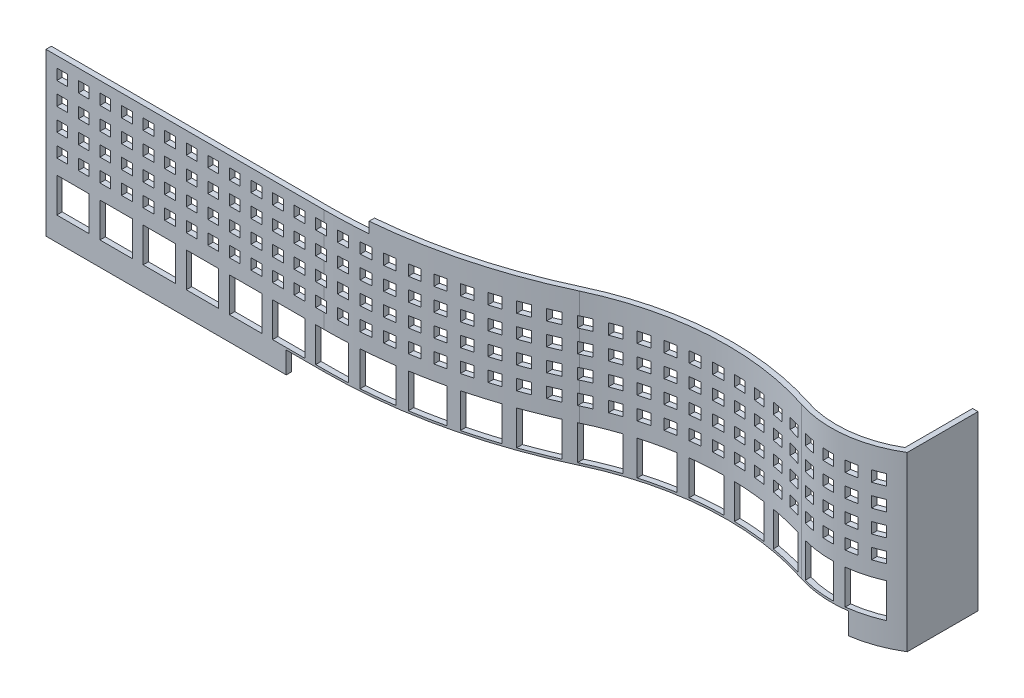
from build123d import *

# Parameters (mm, degrees)
EXTRUDE_1_DEPTH     = 16
SKETCH_2_W          = 29.766559657
SKETCH_2_H          = 1
CUT_EXTRUDE_1_DEPTH = 15
SKETCH_3_W          = 1
SKETCH_3_H          = 1
SKETCH_3_W_2        = 3
SKETCH_3_H_2        = 3.2
SKETCH_3_W_3        = 47
SKETCH_3_H_3        = 5.280191192
CUT_EXTRUDE_2_DEPTH = 61.518592185


with BuildPart() as part:
    # 草图1 → 凸台-拉伸1 (new body)
    with BuildSketch(Plane(origin=(0, 0, 0), x_dir=(1, 0, 0), z_dir=(0, 1, 0))):
        with BuildLine():
            Line((52, -18.660254038), (52, -12.386406803))
            Line((52, -12.386406803), (52.5, -12.386406803))
            Line((52.5, -12.386406803), (52.5, -18.94427191))
            ThreePointArc((52.5, -18.94427191), (48.232411749, -20.427423521), (43.736650726, -19.980007591))
            ThreePointArc((43.736650726, -19.980007591), (33.93226823, -18.726469875), (24.356732206, -21.177262152))
            ThreePointArc((24.356732206, -21.177262152), (14.916767924, -24.406167522), (5, -25.5))
            Line((5, -25.5), (-17.47140521, -25.5))
            Line((-17.47140521, -25.5), (-20.766559657, -25.5))
            Line((-20.766559657, -25.5), (-20.766559657, -25))
            Line((-20.766559657, -25), (-17.47140521, -25))
            Line((-17.47140521, -25), (5, -25))
            ThreePointArc((5, -25), (14.807792452, -23.918187659), (24.144020863, -20.724764765))
            ThreePointArc((24.144020863, -20.724764765), (33.901437956, -18.227421286), (43.892048311, -19.504769134))
            ThreePointArc((43.892048311, -19.504769134), (48.035984141, -19.946192078), (52, -18.660254038))
        make_face()
    extrude(amount=EXTRUDE_1_DEPTH)

    # 草图2 → 切除-拉伸1 (cut)
    with BuildSketch(Plane.XY.offset(25.5)):
        with Locations((-5.883279829, 15.5)):
            Rectangle(SKETCH_2_W, SKETCH_2_H)
    extrude(amount=-CUT_EXTRUDE_1_DEPTH, mode=Mode.SUBTRACT)

    # 草图3 → 切除-拉伸2 (cut, through all)
    with BuildSketch(Plane.XY):
        with Locations((48.733440343, 13.5)):
            Rectangle(SKETCH_3_W, SKETCH_3_H)
        with Locations((-19.266559657, 13.5)):
            Rectangle(SKETCH_3_W, SKETCH_3_H)
        with Locations((-17.266559657, 13.5)):
            Rectangle(SKETCH_3_W, SKETCH_3_H)
        with Locations((-15.266559657, 13.5)):
            Rectangle(SKETCH_3_W, SKETCH_3_H)
        with Locations((-13.266559657, 13.5)):
            Rectangle(SKETCH_3_W, SKETCH_3_H)
        with Locations((-11.266559657, 13.5)):
            Rectangle(SKETCH_3_W, SKETCH_3_H)
        with Locations((-9.266559657, 13.5)):
            Rectangle(SKETCH_3_W, SKETCH_3_H)
        with Locations((-7.266559657, 13.5)):
            Rectangle(SKETCH_3_W, SKETCH_3_H)
        with Locations((-5.266559657, 13.5)):
            Rectangle(SKETCH_3_W, SKETCH_3_H)
        with Locations((-3.266559657, 13.5)):
            Rectangle(SKETCH_3_W, SKETCH_3_H)
        with Locations((-1.266559657, 13.5)):
            Rectangle(SKETCH_3_W, SKETCH_3_H)
        with Locations((0.733440343, 13.5)):
            Rectangle(SKETCH_3_W, SKETCH_3_H)
        with Locations((2.733440343, 13.5)):
            Rectangle(SKETCH_3_W, SKETCH_3_H)
        with Locations((4.733440343, 13.5)):
            Rectangle(SKETCH_3_W, SKETCH_3_H)
        with Locations((6.733440343, 13.5)):
            Rectangle(SKETCH_3_W, SKETCH_3_H)
        with Locations((8.733440343, 13.5)):
            Rectangle(SKETCH_3_W, SKETCH_3_H)
        with Locations((10.733440343, 13.5)):
            Rectangle(SKETCH_3_W, SKETCH_3_H)
        with Locations((12.733440343, 13.5)):
            Rectangle(SKETCH_3_W, SKETCH_3_H)
        with Locations((14.733440343, 13.5)):
            Rectangle(SKETCH_3_W, SKETCH_3_H)
        with Locations((16.733440343, 13.5)):
            Rectangle(SKETCH_3_W, SKETCH_3_H)
        with Locations((18.733440343, 13.5)):
            Rectangle(SKETCH_3_W, SKETCH_3_H)
        with Locations((20.733440343, 13.5)):
            Rectangle(SKETCH_3_W, SKETCH_3_H)
        with Locations((22.733440343, 13.5)):
            Rectangle(SKETCH_3_W, SKETCH_3_H)
        with Locations((24.733440343, 13.5)):
            Rectangle(SKETCH_3_W, SKETCH_3_H)
        with Locations((26.733440343, 13.5)):
            Rectangle(SKETCH_3_W, SKETCH_3_H)
        with Locations((28.733440343, 13.5)):
            Rectangle(SKETCH_3_W, SKETCH_3_H)
        with Locations((30.733440343, 13.5)):
            Rectangle(SKETCH_3_W, SKETCH_3_H)
        with Locations((32.733440343, 13.5)):
            Rectangle(SKETCH_3_W, SKETCH_3_H)
        with Locations((34.733440343, 13.5)):
            Rectangle(SKETCH_3_W, SKETCH_3_H)
        with Locations((36.733440343, 13.5)):
            Rectangle(SKETCH_3_W, SKETCH_3_H)
        with Locations((38.733440343, 13.5)):
            Rectangle(SKETCH_3_W, SKETCH_3_H)
        with Locations((40.733440343, 13.5)):
            Rectangle(SKETCH_3_W, SKETCH_3_H)
        with Locations((42.733440343, 13.5)):
            Rectangle(SKETCH_3_W, SKETCH_3_H)
        with Locations((44.733440343, 13.5)):
            Rectangle(SKETCH_3_W, SKETCH_3_H)
        with Locations((46.733440343, 13.5)):
            Rectangle(SKETCH_3_W, SKETCH_3_H)
        with Locations((-19.266559657, 11.425)):
            Rectangle(SKETCH_3_W, SKETCH_3_H)
        with Locations((-17.266559657, 11.425)):
            Rectangle(SKETCH_3_W, SKETCH_3_H)
        with Locations((-15.266559657, 11.425)):
            Rectangle(SKETCH_3_W, SKETCH_3_H)
        with Locations((-13.266559657, 11.425)):
            Rectangle(SKETCH_3_W, SKETCH_3_H)
        with Locations((-11.266559657, 11.425)):
            Rectangle(SKETCH_3_W, SKETCH_3_H)
        with Locations((-9.266559657, 11.425)):
            Rectangle(SKETCH_3_W, SKETCH_3_H)
        with Locations((-7.266559657, 11.425)):
            Rectangle(SKETCH_3_W, SKETCH_3_H)
        with Locations((-5.266559657, 11.425)):
            Rectangle(SKETCH_3_W, SKETCH_3_H)
        with Locations((-3.266559657, 11.425)):
            Rectangle(SKETCH_3_W, SKETCH_3_H)
        with Locations((-1.266559657, 11.425)):
            Rectangle(SKETCH_3_W, SKETCH_3_H)
        with Locations((0.733440343, 11.425)):
            Rectangle(SKETCH_3_W, SKETCH_3_H)
        with Locations((2.733440343, 11.425)):
            Rectangle(SKETCH_3_W, SKETCH_3_H)
        with Locations((4.733440343, 11.425)):
            Rectangle(SKETCH_3_W, SKETCH_3_H)
        with Locations((6.733440343, 11.425)):
            Rectangle(SKETCH_3_W, SKETCH_3_H)
        with Locations((8.733440343, 11.425)):
            Rectangle(SKETCH_3_W, SKETCH_3_H)
        with Locations((10.733440343, 11.425)):
            Rectangle(SKETCH_3_W, SKETCH_3_H)
        with Locations((12.733440343, 11.425)):
            Rectangle(SKETCH_3_W, SKETCH_3_H)
        with Locations((14.733440343, 11.425)):
            Rectangle(SKETCH_3_W, SKETCH_3_H)
        with Locations((16.733440343, 11.425)):
            Rectangle(SKETCH_3_W, SKETCH_3_H)
        with Locations((18.733440343, 11.425)):
            Rectangle(SKETCH_3_W, SKETCH_3_H)
        with Locations((20.733440343, 11.425)):
            Rectangle(SKETCH_3_W, SKETCH_3_H)
        with Locations((22.733440343, 11.425)):
            Rectangle(SKETCH_3_W, SKETCH_3_H)
        with Locations((24.733440343, 11.425)):
            Rectangle(SKETCH_3_W, SKETCH_3_H)
        with Locations((26.733440343, 11.425)):
            Rectangle(SKETCH_3_W, SKETCH_3_H)
        with Locations((28.733440343, 11.425)):
            Rectangle(SKETCH_3_W, SKETCH_3_H)
        with Locations((30.733440343, 11.425)):
            Rectangle(SKETCH_3_W, SKETCH_3_H)
        with Locations((32.733440343, 11.425)):
            Rectangle(SKETCH_3_W, SKETCH_3_H)
        with Locations((34.733440343, 11.425)):
            Rectangle(SKETCH_3_W, SKETCH_3_H)
        with Locations((36.733440343, 11.425)):
            Rectangle(SKETCH_3_W, SKETCH_3_H)
        with Locations((38.733440343, 11.425)):
            Rectangle(SKETCH_3_W, SKETCH_3_H)
        with Locations((40.733440343, 11.425)):
            Rectangle(SKETCH_3_W, SKETCH_3_H)
        with Locations((42.733440343, 11.425)):
            Rectangle(SKETCH_3_W, SKETCH_3_H)
        with Locations((44.733440343, 11.425)):
            Rectangle(SKETCH_3_W, SKETCH_3_H)
        with Locations((46.733440343, 11.425)):
            Rectangle(SKETCH_3_W, SKETCH_3_H)
        with Locations((-19.266559657, 9.35)):
            Rectangle(SKETCH_3_W, SKETCH_3_H)
        with Locations((-17.266559657, 9.35)):
            Rectangle(SKETCH_3_W, SKETCH_3_H)
        with Locations((-15.266559657, 9.35)):
            Rectangle(SKETCH_3_W, SKETCH_3_H)
        with Locations((-13.266559657, 9.35)):
            Rectangle(SKETCH_3_W, SKETCH_3_H)
        with Locations((-11.266559657, 9.35)):
            Rectangle(SKETCH_3_W, SKETCH_3_H)
        with Locations((-9.266559657, 9.35)):
            Rectangle(SKETCH_3_W, SKETCH_3_H)
        with Locations((-7.266559657, 9.35)):
            Rectangle(SKETCH_3_W, SKETCH_3_H)
        with Locations((-5.266559657, 9.35)):
            Rectangle(SKETCH_3_W, SKETCH_3_H)
        with Locations((-3.266559657, 9.35)):
            Rectangle(SKETCH_3_W, SKETCH_3_H)
        with Locations((-1.266559657, 9.35)):
            Rectangle(SKETCH_3_W, SKETCH_3_H)
        with Locations((0.733440343, 9.35)):
            Rectangle(SKETCH_3_W, SKETCH_3_H)
        with Locations((2.733440343, 9.35)):
            Rectangle(SKETCH_3_W, SKETCH_3_H)
        with Locations((4.733440343, 9.35)):
            Rectangle(SKETCH_3_W, SKETCH_3_H)
        with Locations((6.733440343, 9.35)):
            Rectangle(SKETCH_3_W, SKETCH_3_H)
        with Locations((8.733440343, 9.35)):
            Rectangle(SKETCH_3_W, SKETCH_3_H)
        with Locations((10.733440343, 9.35)):
            Rectangle(SKETCH_3_W, SKETCH_3_H)
        with Locations((12.733440343, 9.35)):
            Rectangle(SKETCH_3_W, SKETCH_3_H)
        with Locations((14.733440343, 9.35)):
            Rectangle(SKETCH_3_W, SKETCH_3_H)
        with Locations((16.733440343, 9.35)):
            Rectangle(SKETCH_3_W, SKETCH_3_H)
        with Locations((18.733440343, 9.35)):
            Rectangle(SKETCH_3_W, SKETCH_3_H)
        with Locations((20.733440343, 9.35)):
            Rectangle(SKETCH_3_W, SKETCH_3_H)
        with Locations((22.733440343, 9.35)):
            Rectangle(SKETCH_3_W, SKETCH_3_H)
        with Locations((24.733440343, 9.35)):
            Rectangle(SKETCH_3_W, SKETCH_3_H)
        with Locations((26.733440343, 9.35)):
            Rectangle(SKETCH_3_W, SKETCH_3_H)
        with Locations((28.733440343, 9.35)):
            Rectangle(SKETCH_3_W, SKETCH_3_H)
        with Locations((30.733440343, 9.35)):
            Rectangle(SKETCH_3_W, SKETCH_3_H)
        with Locations((32.733440343, 9.35)):
            Rectangle(SKETCH_3_W, SKETCH_3_H)
        with Locations((34.733440343, 9.35)):
            Rectangle(SKETCH_3_W, SKETCH_3_H)
        with Locations((36.733440343, 9.35)):
            Rectangle(SKETCH_3_W, SKETCH_3_H)
        with Locations((38.733440343, 9.35)):
            Rectangle(SKETCH_3_W, SKETCH_3_H)
        with Locations((40.733440343, 9.35)):
            Rectangle(SKETCH_3_W, SKETCH_3_H)
        with Locations((42.733440343, 9.35)):
            Rectangle(SKETCH_3_W, SKETCH_3_H)
        with Locations((44.733440343, 9.35)):
            Rectangle(SKETCH_3_W, SKETCH_3_H)
        with Locations((46.733440343, 9.35)):
            Rectangle(SKETCH_3_W, SKETCH_3_H)
        with Locations((-19.266559657, 7.275)):
            Rectangle(SKETCH_3_W, SKETCH_3_H)
        with Locations((-17.266559657, 7.275)):
            Rectangle(SKETCH_3_W, SKETCH_3_H)
        with Locations((-15.266559657, 7.275)):
            Rectangle(SKETCH_3_W, SKETCH_3_H)
        with Locations((-13.266559657, 7.275)):
            Rectangle(SKETCH_3_W, SKETCH_3_H)
        with Locations((-11.266559657, 7.275)):
            Rectangle(SKETCH_3_W, SKETCH_3_H)
        with Locations((-9.266559657, 7.275)):
            Rectangle(SKETCH_3_W, SKETCH_3_H)
        with Locations((-7.266559657, 7.275)):
            Rectangle(SKETCH_3_W, SKETCH_3_H)
        with Locations((-5.266559657, 7.275)):
            Rectangle(SKETCH_3_W, SKETCH_3_H)
        with Locations((-3.266559657, 7.275)):
            Rectangle(SKETCH_3_W, SKETCH_3_H)
        with Locations((-1.266559657, 7.275)):
            Rectangle(SKETCH_3_W, SKETCH_3_H)
        with Locations((0.733440343, 7.275)):
            Rectangle(SKETCH_3_W, SKETCH_3_H)
        with Locations((2.733440343, 7.275)):
            Rectangle(SKETCH_3_W, SKETCH_3_H)
        with Locations((4.733440343, 7.275)):
            Rectangle(SKETCH_3_W, SKETCH_3_H)
        with Locations((6.733440343, 7.275)):
            Rectangle(SKETCH_3_W, SKETCH_3_H)
        with Locations((8.733440343, 7.275)):
            Rectangle(SKETCH_3_W, SKETCH_3_H)
        with Locations((10.733440343, 7.275)):
            Rectangle(SKETCH_3_W, SKETCH_3_H)
        with Locations((12.733440343, 7.275)):
            Rectangle(SKETCH_3_W, SKETCH_3_H)
        with Locations((14.733440343, 7.275)):
            Rectangle(SKETCH_3_W, SKETCH_3_H)
        with Locations((16.733440343, 7.275)):
            Rectangle(SKETCH_3_W, SKETCH_3_H)
        with Locations((18.733440343, 7.275)):
            Rectangle(SKETCH_3_W, SKETCH_3_H)
        with Locations((20.733440343, 7.275)):
            Rectangle(SKETCH_3_W, SKETCH_3_H)
        with Locations((22.733440343, 7.275)):
            Rectangle(SKETCH_3_W, SKETCH_3_H)
        with Locations((24.733440343, 7.275)):
            Rectangle(SKETCH_3_W, SKETCH_3_H)
        with Locations((26.733440343, 7.275)):
            Rectangle(SKETCH_3_W, SKETCH_3_H)
        with Locations((28.733440343, 7.275)):
            Rectangle(SKETCH_3_W, SKETCH_3_H)
        with Locations((30.733440343, 7.275)):
            Rectangle(SKETCH_3_W, SKETCH_3_H)
        with Locations((32.733440343, 7.275)):
            Rectangle(SKETCH_3_W, SKETCH_3_H)
        with Locations((34.733440343, 7.275)):
            Rectangle(SKETCH_3_W, SKETCH_3_H)
        with Locations((36.733440343, 7.275)):
            Rectangle(SKETCH_3_W, SKETCH_3_H)
        with Locations((38.733440343, 7.275)):
            Rectangle(SKETCH_3_W, SKETCH_3_H)
        with Locations((40.733440343, 7.275)):
            Rectangle(SKETCH_3_W, SKETCH_3_H)
        with Locations((42.733440343, 7.275)):
            Rectangle(SKETCH_3_W, SKETCH_3_H)
        with Locations((44.733440343, 7.275)):
            Rectangle(SKETCH_3_W, SKETCH_3_H)
        with Locations((46.733440343, 7.275)):
            Rectangle(SKETCH_3_W, SKETCH_3_H)
        with Locations((-18.266559657, 3.8)):
            Rectangle(SKETCH_3_W_2, SKETCH_3_H_2)
        with Locations((-14.266559657, 3.8)):
            Rectangle(SKETCH_3_W_2, SKETCH_3_H_2)
        with Locations((-10.266559657, 3.8)):
            Rectangle(SKETCH_3_W_2, SKETCH_3_H_2)
        with Locations((-6.266559657, 3.8)):
            Rectangle(SKETCH_3_W_2, SKETCH_3_H_2)
        with Locations((-2.266559657, 3.8)):
            Rectangle(SKETCH_3_W_2, SKETCH_3_H_2)
        with Locations((1.733440343, 3.8)):
            Rectangle(SKETCH_3_W_2, SKETCH_3_H_2)
        with Locations((5.733440343, 3.8)):
            Rectangle(SKETCH_3_W_2, SKETCH_3_H_2)
        with Locations((9.733440343, 3.8)):
            Rectangle(SKETCH_3_W_2, SKETCH_3_H_2)
        with Locations((13.733440343, 3.8)):
            Rectangle(SKETCH_3_W_2, SKETCH_3_H_2)
        with Locations((17.733440343, 3.8)):
            Rectangle(SKETCH_3_W_2, SKETCH_3_H_2)
        with Locations((21.733440343, 3.8)):
            Rectangle(SKETCH_3_W_2, SKETCH_3_H_2)
        with Locations((25.733440343, 3.8)):
            Rectangle(SKETCH_3_W_2, SKETCH_3_H_2)
        with Locations((29.733440343, 3.8)):
            Rectangle(SKETCH_3_W_2, SKETCH_3_H_2)
        with Locations((33.733440343, 3.8)):
            Rectangle(SKETCH_3_W_2, SKETCH_3_H_2)
        with Locations((37.733440343, 3.8)):
            Rectangle(SKETCH_3_W_2, SKETCH_3_H_2)
        with Locations((41.733440343, 3.8)):
            Rectangle(SKETCH_3_W_2, SKETCH_3_H_2)
        with Locations((45.733440343, 3.8)):
            Rectangle(SKETCH_3_W_2, SKETCH_3_H_2)
        with Locations((48.733440343, 11.425)):
            Rectangle(SKETCH_3_W, SKETCH_3_H)
        with Locations((48.733440343, 9.35)):
            Rectangle(SKETCH_3_W, SKETCH_3_H)
        with Locations((48.733440343, 7.275)):
            Rectangle(SKETCH_3_W, SKETCH_3_H)
        with Locations((50.733440343, 13.5)):
            Rectangle(SKETCH_3_W, SKETCH_3_H)
        with Locations((50.733440343, 11.425)):
            Rectangle(SKETCH_3_W, SKETCH_3_H)
        with Locations((50.733440343, 9.35)):
            Rectangle(SKETCH_3_W, SKETCH_3_H)
        with Locations((50.733440343, 7.275)):
            Rectangle(SKETCH_3_W, SKETCH_3_H)
        with Locations((49.733440343, 3.8)):
            Rectangle(SKETCH_3_W_2, SKETCH_3_H_2)
        with Locations((25, -0.640095596)):
            Rectangle(SKETCH_3_W_3, SKETCH_3_H_3)
    extrude(amount=CUT_EXTRUDE_2_DEPTH, mode=Mode.SUBTRACT)


solid = part.part
